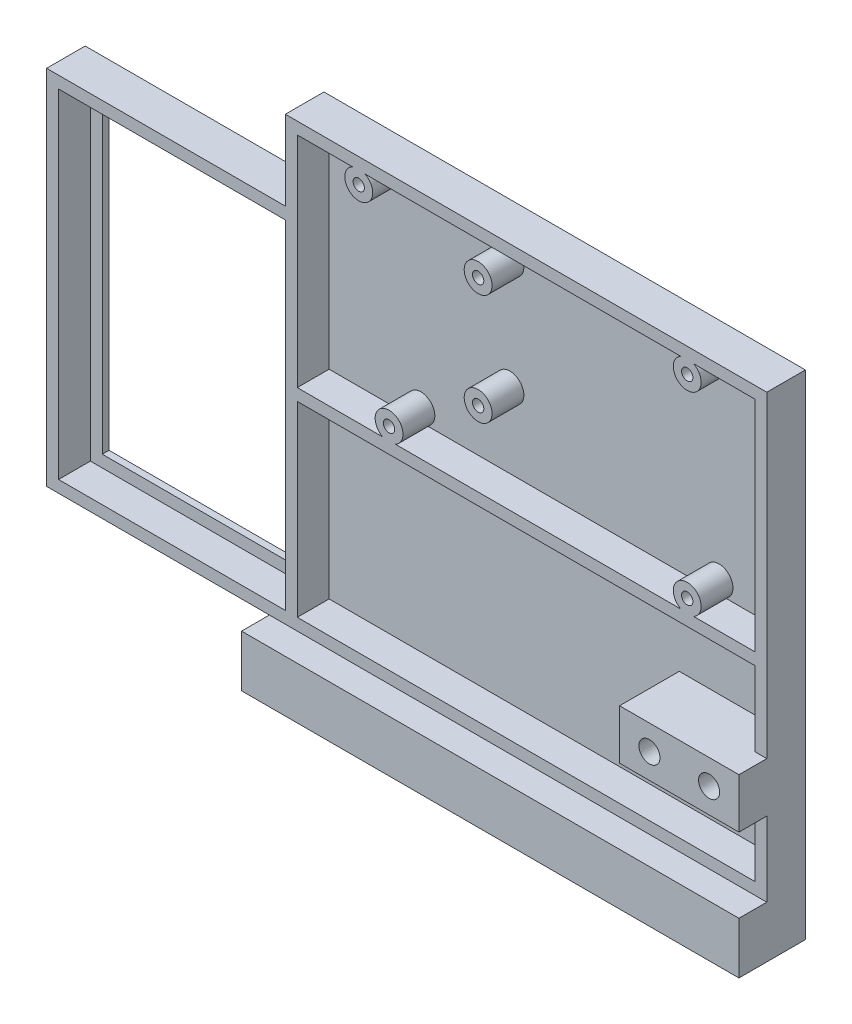
from build123d import *

# Parameters (mm, degrees)
SKETCH1_W                = 121
SKETCH1_H                = 113
SKETCH1_R                = 2.65
SKETCH1_R_2              = 1.425
SKETCH1_W_2              = 85
SKETCH1_H_2              = 57
BOSS_EXTRUDE1_DEPTH      = 10
SKETCH2_W                = 85
SKETCH2_H                = 57
BOSS_EXTRUDE2_DEPTH      = 2
SKETCH4_W                = 27
SKETCH4_H                = 45.5
CUT_EXTRUDE1_DEPTH       = 8
SKETCH5_W                = 10.5
SKETCH5_H                = 10.5
CUT_EXTRUDE2_DEPTH       = 7
SKETCH7_R                = 3
SKETCH7_R_2              = 1.425
SKETCH7_W                = 30
SKETCH7_H                = 12.5
SKETCH7_R_3              = 2.65
BOSS_EXTRUDE4_DEPTH      = 7
CHAMFER2_SIZE            = 2
CHAMFER2_SIZE_2          = 7
SKETCH9_W                = 55
SKETCH9_H                = 113
BOSS_EXTRUDE5_DEPTH      = 17
SKETCH10_R               = 1.425
CUT_EXTRUDE3_DEPTH       = 131.504789184
SKETCH11_W               = 52
SKETCH11_H               = 107
SKETCH11_R               = 3.5
CUT_EXTRUDE4_DEPTH       = 15
SKETCH12_W               = 55
SKETCH12_H               = 113
SKETCH12_R               = 3.5
CUT_EXTRUDE5_DEPTH       = 7
SKETCH13_W               = 125
SKETCH13_H               = 17
SKETCH13_R               = 1.9
BOSS_EXTRUDE6_DEPTH      = 13
SKETCH16_W               = 57
SKETCH16_H               = 85
CUT_EXTRUDE7_DEPTH       = 15
BOSS_EXTRUDE8_REACH      = 140.313
SKETCH17_W               = 63
SKETCH17_H               = 91
SKETCH17_W_2             = 57
SKETCH17_H_2             = 85
CUT_EXTRUDE8_DEPTH       = 142.987675522
CUT_EXTRUDE8_DEPTH_BACK  = 142.987675522
SKETCH18_W               = 181
SKETCH18_H               = 22
SKETCH19_W               = 118
SKETCH19_H               = 38
CUT_EXTRUDE9_DEPTH       = 15
SKETCH20_W               = 27
SKETCH20_H               = 3
BOSS_EXTRUDE9_DEPTH      = 8
BOSS_EXTRUDE10_START     = -2
SKETCH21_W               = 118
SKETCH21_H               = 38
SKETCH21_R               = 1.425
SKETCH21_W_2             = 60
SKETCH21_H_2             = 20
SKETCH21_W_3             = 56
SKETCH21_H_3             = 13
BOSS_EXTRUDE10_DEPTH     = 2
SKETCH23_R               = 1.425
SKETCH23_R_2             = 3.5
BOSS_EXTRUDE11_DEPTH     = 8
CUT_EXTRUDE10_DEPTH      = 142.987675522
CUT_EXTRUDE10_DEPTH_BACK = 142.987675522
SKETCH24_W               = 60
SKETCH24_H               = 20
SKETCH24_W_2             = 56
SKETCH24_H_2             = 13
SKETCH24_W_3             = 51
SKETCH24_H_3             = 79
CHAMFER3_SIZE            = 0.3


with BuildPart() as part:
    # Sketch1 → Boss-Extrude1 (new body)
    with BuildSketch(Plane.XY):
        with Locations((15, -25)):
            Rectangle(SKETCH1_W, SKETCH1_H)
        with Locations((68, -56.5)):
            Circle(SKETCH1_R, mode=Mode.SUBTRACT)
        with Locations((53, -56.5)):
            Circle(SKETCH1_R, mode=Mode.SUBTRACT)
        with Locations((51, -21.5)):
            Circle(SKETCH1_R_2, mode=Mode.SUBTRACT)
        with Locations((68, -21.5)):
            Circle(SKETCH1_R_2, mode=Mode.SUBTRACT)
        Rectangle(SKETCH1_W_2, SKETCH1_H_2, mode=Mode.SUBTRACT)
    extrude(amount=BOSS_EXTRUDE1_DEPTH)

    # Sketch2 → Boss-Extrude2 (add)
    with BuildSketch(Plane(origin=(0, 0, 0), x_dir=(-1, 0, 0), z_dir=(0, 0, -1))):
        Rectangle(SKETCH2_W, SKETCH2_H)
    extrude(amount=-BOSS_EXTRUDE2_DEPTH)

    # Sketch4 → Cut-Extrude1 (cut)
    with BuildSketch(Plane.XY.offset(10)):
        with Locations((59, 5.75)):
            Rectangle(SKETCH4_W, SKETCH4_H)
        Polygon((45.5, -31.5), (-42.5, -31.5), (-42.5, -78.5), (72.5, -78.5), (72.5, -62.75), (45.5, -62.75), (45.5, -50.25), (72.5, -50.25), (72.5, -26), (45.5, -26), align=None)
    extrude(amount=-CUT_EXTRUDE1_DEPTH, mode=Mode.SUBTRACT)

    # Sketch5 → Cut-Extrude2 (cut)
    with BuildSketch(Plane(origin=(0, 0, 0), x_dir=(-1, 0, 0), z_dir=(0, 0, -1))):
        with Locations((-68, -56.5)):
            Rectangle(SKETCH5_W, SKETCH5_H)
        with Locations((-53, -56.5)):
            Rectangle(SKETCH5_W, SKETCH5_H)
    extrude(amount=-CUT_EXTRUDE2_DEPTH, mode=Mode.SUBTRACT)

    # Sketch7 → Boss-Extrude4 (add)
    # profile 1 of 3: a face of its own
    with BuildSketch(Plane.XY.offset(10)):
        with Locations(Location((51, -21.5, 0), (0, 0, 180))):
            Circle(SKETCH7_R)
        with Locations((51, -21.5)):
            Circle(SKETCH7_R_2, mode=Mode.SUBTRACT)
    # profile 2 of 3: a face of its own
    with BuildSketch(Plane.XY.offset(10)):
        with Locations(Location((68, -21.5, 0), (0, 0, 180))):
            Circle(SKETCH7_R)
        with Locations((68, -21.5)):
            Circle(SKETCH7_R_2, mode=Mode.SUBTRACT)
    # profile 3 of 3: a face of its own
    with BuildSketch(Plane.XY.offset(10)):
        with Locations((60.5, -56.5)):
            Rectangle(SKETCH7_W, SKETCH7_H)
        with Locations(Location((53, -56.5, 0), (0, 0, 180))):
            Circle(SKETCH7_R_3, mode=Mode.SUBTRACT)
        with Locations((68, -56.5)):
            Circle(SKETCH7_R_3, mode=Mode.SUBTRACT)
    extrude(amount=BOSS_EXTRUDE4_DEPTH)

    # Chamfer2
    # the kernel refuses this chamfer: 7, 2 mm, written as the material it adds along each edge
    with BuildSketch(Plane(origin=(51, -21.5, 10), x_dir=(-1, 0, 0), z_dir=(0, 1, 0))) as chamfer2_piece_1_section:
        Polygon((3 + CHAMFER2_SIZE, 0), (3, CHAMFER2_SIZE_2), (3, 0), align=None)
    chamfer2_piece_1 = revolve(axis=Axis((51, -21.5, 10), (0, 0, 1)), mode=Mode.PRIVATE)
    chamfer2_piece_1 = split(chamfer2_piece_1, bisect_by=Plane(origin=(54.98341161, -26, 13.349658262), z_dir=(0, 1, 0)), keep=Keep.TOP, mode=Mode.PRIVATE)
    chamfer2_piece_1 = split(chamfer2_piece_1, bisect_by=Plane(origin=(54.98341161, -17, 13.349658262), z_dir=(0, -1, 0)), keep=Keep.TOP, mode=Mode.PRIVATE)
    chamfer2_piece_1 = split(chamfer2_piece_1, bisect_by=Plane(origin=(54.98341161, -21.5, 17), z_dir=(0, 0, -1)), keep=Keep.TOP, mode=Mode.PRIVATE)
    add(chamfer2_piece_1)
    with BuildSketch(Plane(origin=(68, -21.5, 10), x_dir=(-1, 0, 0), z_dir=(0, 1, 0))) as chamfer2_piece_2_section:
        Polygon((3 + CHAMFER2_SIZE, 0), (3, CHAMFER2_SIZE_2), (3, 0), align=None)
    chamfer2_piece_2 = revolve(axis=Axis((68, -21.5, 10), (0, 0, 1)), mode=Mode.PRIVATE)
    chamfer2_piece_2 = split(chamfer2_piece_2, bisect_by=Plane(origin=(71.983411611, -26, 13.349658263), z_dir=(0, 1, 0)), keep=Keep.TOP, mode=Mode.PRIVATE)
    chamfer2_piece_2 = split(chamfer2_piece_2, bisect_by=Plane(origin=(71.983411611, -17, 13.349658263), z_dir=(0, -1, 0)), keep=Keep.TOP, mode=Mode.PRIVATE)
    chamfer2_piece_2 = split(chamfer2_piece_2, bisect_by=Plane(origin=(71.983411611, -21.5, 17), z_dir=(0, 0, -1)), keep=Keep.TOP, mode=Mode.PRIVATE)
    add(chamfer2_piece_2)

    # Sketch9 → Boss-Extrude5 (add)
    with BuildSketch(Plane(origin=(0, 0, 0), x_dir=(-1, 0, 0), z_dir=(0, 0, -1))):
        with Locations((73, -25)):
            Rectangle(SKETCH9_W, SKETCH9_H)
    extrude(amount=-BOSS_EXTRUDE5_DEPTH)

    # Sketch10 → Cut-Extrude3 (cut, through all)
    with BuildSketch(Plane.XY.offset(17)):
        with Locations((-90.5, -13.5)):
            Circle(SKETCH10_R)
        with Locations((-50.5, -13.5)):
            Circle(SKETCH10_R)
        with Locations((-90.5, -73.5)):
            Circle(SKETCH10_R)
        with Locations((-50.5, -73.5)):
            Circle(SKETCH10_R)
    extrude(amount=-CUT_EXTRUDE3_DEPTH, mode=Mode.SUBTRACT)

    # Sketch11 → Cut-Extrude4 (cut)
    with BuildSketch(Plane.XY.offset(17)):
        with Locations((-71.5, -25)):
            Rectangle(SKETCH11_W, SKETCH11_H)
        with Locations((-50.5, -73.5)):
            Circle(SKETCH11_R, mode=Mode.SUBTRACT)
        with Locations((-50.5, -13.5)):
            Circle(SKETCH11_R, mode=Mode.SUBTRACT)
        with Locations((-90.5, -73.5)):
            Circle(SKETCH11_R, mode=Mode.SUBTRACT)
        with Locations((-90.5, -13.5)):
            Circle(SKETCH11_R, mode=Mode.SUBTRACT)
    extrude(amount=-CUT_EXTRUDE4_DEPTH, mode=Mode.SUBTRACT)

    # Sketch12 → Cut-Extrude5 (cut)
    with BuildSketch(Plane.XY.offset(17)):
        with Locations((-73, -25)):
            Rectangle(SKETCH12_W, SKETCH12_H)
        with Locations((-90.5, -13.5)):
            Circle(SKETCH12_R, mode=Mode.SUBTRACT)
        with Locations((-50.5, -13.5)):
            Circle(SKETCH12_R, mode=Mode.SUBTRACT)
        with Locations((-90.5, -73.5)):
            Circle(SKETCH12_R, mode=Mode.SUBTRACT)
        with Locations((-50.5, -73.5)):
            Circle(SKETCH12_R, mode=Mode.SUBTRACT)
    extrude(amount=-CUT_EXTRUDE5_DEPTH, mode=Mode.SUBTRACT)

    # Sketch13 → Boss-Extrude6 (add)
    with BuildSketch(Plane.XZ.offset(81.5)):
        with Locations((13, 8.5)):
            Rectangle(SKETCH13_W, SKETCH13_H)
        with Locations(Location((-16.25, 4, 0), (0, 0, 90))):
            Circle(SKETCH13_R, mode=Mode.SUBTRACT)
        with Locations(Location((42.25, 4, 0), (0, 0, 90))):
            Circle(SKETCH13_R, mode=Mode.SUBTRACT)
        with Locations(Location((71.5, 4, 0), (0, 0, 90))):
            Circle(SKETCH13_R, mode=Mode.SUBTRACT)
        with Locations(Location((-45.5, 4, 0), (0, 0, 90))):
            Circle(SKETCH13_R, mode=Mode.SUBTRACT)
    extrude(amount=BOSS_EXTRUDE6_DEPTH)

    # Sketch16 → Cut-Extrude7 (cut)
    with BuildSketch(Plane.XY.offset(17)):
        with Locations((-74, -36)):
            Rectangle(SKETCH16_W, SKETCH16_H)
    extrude(amount=-CUT_EXTRUDE7_DEPTH, mode=Mode.SUBTRACT)

    # Boss-Extrude8: up to this face of the body (flat: up to its plane)
    boss_extrude8_end = Plane(part.part.faces().sort_by_distance((-11.281306372, -29.469785965, 0))[0])
    # Sketch17 → Boss-Extrude8 (add, up to the picked face)
    with BuildSketch(Plane.XY.offset(10), mode=Mode.PRIVATE) as boss_extrude8_sk1:
        with Locations((-74, -36)):
            Rectangle(SKETCH17_W, SKETCH17_H)
        with Locations((-74, -36)):
            Rectangle(SKETCH17_W_2, SKETCH17_H_2, mode=Mode.SUBTRACT)
    boss_extrude8_tool1 = split(extrude(boss_extrude8_sk1.sketch, amount=-BOSS_EXTRUDE8_REACH, mode=Mode.PRIVATE), bisect_by=boss_extrude8_end, keep=Keep.BOTH, mode=Mode.PRIVATE)
    add(boss_extrude8_tool1.solids().sort_by(Axis((-43.606797, -36, 10), (0, 0, -1)))[0])

    # Sketch18 → Cut-Extrude8 (cut, two sides: drawn at the far end of the back side and taken through both)
    with BuildSketch(Plane.XY.offset(10).offset(-CUT_EXTRUDE8_DEPTH_BACK)):
        with Locations((-15, 20.5)):
            Rectangle(SKETCH18_W, SKETCH18_H)
    extrude(amount=CUT_EXTRUDE8_DEPTH + CUT_EXTRUDE8_DEPTH_BACK, mode=Mode.SUBTRACT)

    # Sketch19 → Cut-Extrude9 (cut)
    with BuildSketch(Plane.XY.offset(17)):
        with Locations((16.5, -9.5)):
            Rectangle(SKETCH19_W, SKETCH19_H)
    extrude(amount=-CUT_EXTRUDE9_DEPTH, mode=Mode.SUBTRACT)

    # Sketch20 → Boss-Extrude9 (add)
    with BuildSketch(Plane.XY.offset(10)):
        with Locations((59, -30)):
            Rectangle(SKETCH20_W, SKETCH20_H)
    extrude(amount=-BOSS_EXTRUDE9_DEPTH)

    # Sketch21 → Boss-Extrude10 (add)
    # profile 1 of 7: a face of its own
    with BuildSketch(Plane.XY.offset(2).offset(BOSS_EXTRUDE10_START)):
        with Locations((16.5, -9.5)):
            Rectangle(SKETCH21_W, SKETCH21_H)
        with Locations((68, -21.5)):
            Circle(SKETCH21_R, mode=Mode.SUBTRACT)
        with Locations((51, -21.5)):
            Circle(SKETCH21_R, mode=Mode.SUBTRACT)
    # profile 2 of 7: a face of its own
    with BuildSketch(Plane.XY.offset(2).offset(BOSS_EXTRUDE10_START)):
        Polygon((-45.5, 6.5), (-45.5, -31.5), (75.5, -31.5), (75.5, -28.5), (-42.5, -28.5), (-42.5, 9.5), (75.5, 9.5), (75.5, 29.5), (-45.5, 29.5), (-45.5, 9.5), align=None)
    # profile 3 of 7: a face of its own
    with BuildSketch(Plane.XY.offset(2).offset(BOSS_EXTRUDE10_START)):
        with Locations((68, -21.5)):
            Circle(SKETCH21_R)
    # profile 4 of 7: a face of its own
    with BuildSketch(Plane.XY.offset(2).offset(BOSS_EXTRUDE10_START)):
        with Locations((51, -21.5)):
            Circle(SKETCH21_R)
    # profile 5 of 7: a face of its own
    with BuildSketch(Plane.XY.offset(2).offset(BOSS_EXTRUDE10_START)):
        with Locations((-75.5, 19.5)):
            Rectangle(SKETCH21_W_2, SKETCH21_H_2)
    # profile 6 of 7: a face of its own
    with BuildSketch(Plane.XY.offset(2).offset(BOSS_EXTRUDE10_START)):
        with Locations((-77.5, -88)):
            Rectangle(SKETCH21_W_3, SKETCH21_H_3)
    # profile 7 of 7: a face of its own
    with BuildSketch(Plane.XY.offset(2).offset(BOSS_EXTRUDE10_START)):
        Polygon((-45.5, -78.5), (-45.5, -31.5), (-45.5, 6.5), (-102.5, 6.5), (-102.5, -78.5), align=None)
    extrude(amount=BOSS_EXTRUDE10_DEPTH)

    # Sketch23 → Boss-Extrude11 (add)
    # profile 1 of 9: a face of its own
    with BuildSketch(Plane.XY.offset(2)):
        with BuildLine():
            Line((-45.5, 29.5), (-45.5, 9.5))
            Line((-45.5, 9.5), (-42.5, 9.5))
            Line((-42.5, 9.5), (-42.5, 26.5))
            Line((-42.5, 26.5), (-28.636064311, 26.5))
            ThreePointArc((-28.636064311, 26.5), (-27.05, 26.88), (-25.463935689, 26.5))
            Line((-25.463935689, 26.5), (53.913935689, 26.5))
            ThreePointArc((53.913935689, 26.5), (55.5, 26.88), (57.086064311, 26.5))
            Line((57.086064311, 26.5), (72.5, 26.5))
            Line((72.5, 26.5), (72.5, -28.5))
            Line((72.5, -28.5), (75.5, -28.5))
            Line((75.5, -28.5), (75.5, 29.5))
            Line((75.5, 29.5), (-45.5, 29.5))
        make_face()
    # profile 2 of 9: a face of its own
    with BuildSketch(Plane.XY.offset(2)):
        with BuildLine():
            Line((-25.463935689, 26.5), (-28.636064311, 26.5))
            ThreePointArc((-28.636064311, 26.5), (-28.88013318, 20.396610561), (-23.55, 23.38))
            ThreePointArc((-23.55, 23.38), (-24.066610561, 25.21013318), (-25.463935689, 26.5))
        make_face()
        with Locations(Location((-27.05, 23.38, 0), (0, 0, 180))):
            Circle(SKETCH23_R, mode=Mode.SUBTRACT)
    # profile 3 of 9: a face of its own
    with BuildSketch(Plane.XY.offset(2)):
        with Locations(Location((2.95, 18.17, 0), (0, 0, 180))):
            Circle(SKETCH23_R_2)
        with Locations(Location((2.95, 18.17, 0), (0, 0, 180))):
            Circle(SKETCH23_R, mode=Mode.SUBTRACT)
    # profile 4 of 9: a face of its own
    with BuildSketch(Plane.XY.offset(2)):
        with BuildLine():
            ThreePointArc((59, 23.38), (58.483389439, 25.21013318), (57.086064311, 26.5))
            Line((57.086064311, 26.5), (53.913935689, 26.5))
            ThreePointArc((53.913935689, 26.5), (53.66986682, 20.396610561), (59, 23.38))
        make_face()
        with Locations(Location((55.5, 23.38, 0), (0, 0, 180))):
            Circle(SKETCH23_R, mode=Mode.SUBTRACT)
    # profile 5 of 9: a face of its own
    with BuildSketch(Plane.XY.offset(2)):
        with Locations(Location((2.95, -9.68, 0), (0, 0, 180))):
            Circle(SKETCH23_R_2)
        with Locations(Location((2.95, -9.68, 0), (0, 0, 180))):
            Circle(SKETCH23_R, mode=Mode.SUBTRACT)
    # profile 6 of 9: a face of its own
    with BuildSketch(Plane.XY.offset(2)):
        with BuildLine():
            ThreePointArc((-15.93, -25.38), (-21.26013318, -22.396610561), (-21.016064311, -28.5))
            Line((-21.016064311, -28.5), (-17.843935689, -28.5))
            ThreePointArc((-17.843935689, -28.5), (-16.446610561, -27.21013318), (-15.93, -25.38))
        make_face()
        with Locations(Location((-19.43, -25.38, 0), (0, 0, 180))):
            Circle(SKETCH23_R, mode=Mode.SUBTRACT)
    # profile 7 of 9: a face of its own
    with BuildSketch(Plane.XY.offset(2)):
        with BuildLine():
            Line((53.913935689, -28.5), (57.086064311, -28.5))
            ThreePointArc((57.086064311, -28.5), (58.483389439, -27.21013318), (59, -25.38))
            ThreePointArc((59, -25.38), (53.66986682, -22.396610561), (53.913935689, -28.5))
        make_face()
        with Locations(Location((55.5, -25.38, 0), (0, 0, 180))):
            Circle(SKETCH23_R, mode=Mode.SUBTRACT)
    # profile 8 of 9: a face of its own
    with BuildSketch(Plane.XY.offset(2)):
        with BuildLine():
            Line((53.913935689, 26.5), (57.086064311, 26.5))
            ThreePointArc((57.086064311, 26.5), (55.5, 26.88), (53.913935689, 26.5))
        make_face()
    # profile 9 of 9: a face of its own
    with BuildSketch(Plane.XY.offset(2)):
        with BuildLine():
            ThreePointArc((-25.463935689, 26.5), (-27.05, 26.88), (-28.636064311, 26.5))
            Line((-28.636064311, 26.5), (-25.463935689, 26.5))
        make_face()
    extrude(amount=BOSS_EXTRUDE11_DEPTH)

    # Sketch24 → Cut-Extrude10 (cut, two sides: drawn at the far end of the back side and taken through both)
    with BuildSketch(Plane.XY.offset(10).offset(-CUT_EXTRUDE10_DEPTH_BACK)):
        with Locations((-75.5, 19.5)):
            Rectangle(SKETCH24_W, SKETCH24_H)
        with Locations((-77.5, -88)):
            Rectangle(SKETCH24_W_2, SKETCH24_H_2)
        with Locations((-74, -36)):
            Rectangle(SKETCH24_W_3, SKETCH24_H_3)
    extrude(amount=CUT_EXTRUDE10_DEPTH + CUT_EXTRUDE10_DEPTH_BACK, mode=Mode.SUBTRACT)

    # Chamfer3
    chamfer3_edges = [part.edges().sort_by_distance(p)[0] for p in [
        (62.75, -56.5, 0),
        (68, -51.25, 0),
        (73.25, -56.5, 0),
        (68, -61.75, 0),
        (58.25, -56.5, 0),
        (53, -61.75, 0),
        (47.75, -56.5, 0),
        (53, -51.25, 0),
        (75.5, -32.5, 0),
        (15, 29.5, 0),
        (-105.5, -36, 0),
        (13, -94.5, 0),
        (-45.5, 19.5, 0),
        (-75.5, 9.5, 0),
        (-77.5, -81.5, 0),
        (-49.5, -88, 0),
        (-74, -75.5, 0),
        (-99.5, -36, 0),
        (-74, 3.5, 0),
        (-48.5, -36, 0),
    ]]
    chamfer(chamfer3_edges, length=CHAMFER3_SIZE)


solid = part.part
